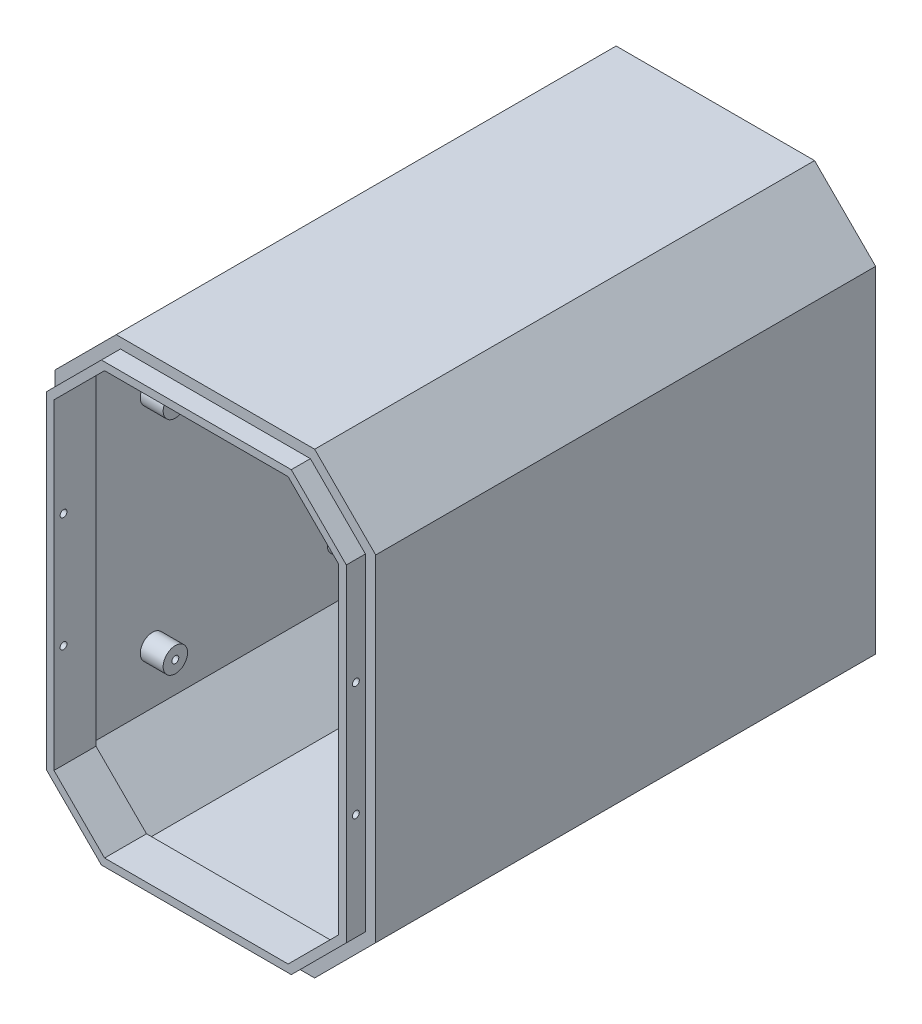
from build123d import *

# Parameters (mm, degrees)
BOSS_1_DEPTH   = 131
CUT_2_DEPTH    = 96.675
CUT_3_DEPTH    = 32.025
S_CUT4_W       = 8
S_CUT4_H       = 28
POCKET_4_DEPTH = 2.7
S_HOLE5_R      = 6
HOLE_5_DEPTH   = 2.7
S_CUT6_W       = 19.4
S_CUT6_H       = 6.3
POCKET_6_DEPTH = 2.7
S_CUT7_W       = 19.4
S_CUT7_H       = 6.3
POCKET_7_DEPTH = 2.7
S_HOLE8_R      = 1.7
HOLE_8_DEPTH   = 2.7
S_HOLE9_R      = 1.7
HOLE_9_DEPTH   = 2.7
S_HOLE10_R     = 1.7
HOLE_10_DEPTH  = 2.7
S_HOLE11_R     = 1.7
HOLE_11_DEPTH  = 2.7
BOSS_12_DEPTH  = 6
BOSS_13_DEPTH  = 5.1
S_CYL14_R      = 3.2
BOSS_14_DEPTH  = 6.5
S_CYL15_R      = 3.2
BOSS_15_DEPTH  = 6.5
S_CYL16_R      = 3.2
BOSS_16_DEPTH  = 6.5
S_CYL17_R      = 3.2
BOSS_17_DEPTH  = 6.5
CUT_18_DEPTH   = 11.2
S_HOLE19_R     = 0.9
HOLE_19_DEPTH  = 2.7
S_HOLE20_R     = 0.9
HOLE_20_DEPTH  = 2.7
S_HOLE21_R     = 0.9
HOLE_21_DEPTH  = 2.7
S_HOLE22_R     = 0.9
HOLE_22_DEPTH  = 2.7
S_HOLE23_R     = 0.9
HOLE_23_DEPTH  = 7.2
S_HOLE24_R     = 0.9
HOLE_24_DEPTH  = 7.2
S_HOLE25_R     = 0.9
HOLE_25_DEPTH  = 7.2
S_HOLE26_R     = 0.9
HOLE_26_DEPTH  = 7.2


with BuildPart() as part:
    # S_prism1 → Boss_1 (new body)
    with BuildSketch(Plane.XY.offset(37)):
        Polygon((42, -44), (42, 44), (26, 60), (-26, 60), (-42, 44), (-42, -44), (-26, -60), (26, -60), align=None)
    extrude(amount=BOSS_1_DEPTH)

    # S_pcut2 → Cut_2 (cut)
    with BuildSketch(Plane.XY.offset(71.425)):
        Polygon((39.5, -42.964466094), (39.5, 42.964466094), (24.964466094, 57.5), (-24.964466094, 57.5), (-39.5, 42.964466094), (-39.5, -42.964466094), (-24.964466094, -57.5), (24.964466094, -57.5), align=None)
    extrude(amount=CUT_2_DEPTH, mode=Mode.SUBTRACT)

    # S_pcut3 → Cut_3 (cut)
    with BuildSketch(Plane.XY.offset(36.9)):
        Polygon((39.5, -42.964466094), (39.5, 42.964466094), (24.964466094, 57.5), (-24.964466094, 57.5), (-39.5, 42.964466094), (-39.5, -42.964466094), (-24.964466094, -57.5), (24.964466094, -57.5), align=None)
    extrude(amount=CUT_3_DEPTH, mode=Mode.SUBTRACT)

    # S_cut4 → Pocket_4 (cut)
    with BuildSketch(Plane.XY.offset(68.825)):
        with Locations((-30, 0)):
            Rectangle(S_CUT4_W, S_CUT4_H)
    extrude(amount=POCKET_4_DEPTH, mode=Mode.SUBTRACT)

    # S_hole5 → Hole_5 (cut)
    with BuildSketch(Plane(origin=(-42.1, 0, 0), x_dir=(0, 0, -1), z_dir=(1, 0, 0))):
        with Locations((-88, 0)):
            Circle(S_HOLE5_R)
    extrude(amount=HOLE_5_DEPTH, mode=Mode.SUBTRACT)

    # S_cut6 → Pocket_6 (cut)
    with BuildSketch(Plane.XY.offset(68.825)):
        with Locations((0, 30.95)):
            Rectangle(S_CUT6_W, S_CUT6_H)
    extrude(amount=POCKET_6_DEPTH, mode=Mode.SUBTRACT)

    # S_cut7 → Pocket_7 (cut)
    with BuildSketch(Plane.XY.offset(68.825)):
        with Locations((0, -30.95)):
            Rectangle(S_CUT7_W, S_CUT7_H)
    extrude(amount=POCKET_7_DEPTH, mode=Mode.SUBTRACT)

    # S_hole8 → Hole_8 (cut)
    with BuildSketch(Plane.XY.offset(68.825)):
        with Locations((-20, -25)):
            Circle(S_HOLE8_R)
    extrude(amount=HOLE_8_DEPTH, mode=Mode.SUBTRACT)

    # S_hole9 → Hole_9 (cut)
    with BuildSketch(Plane.XY.offset(68.825)):
        with Locations((-20, 25)):
            Circle(S_HOLE9_R)
    extrude(amount=HOLE_9_DEPTH, mode=Mode.SUBTRACT)

    # S_hole10 → Hole_10 (cut)
    with BuildSketch(Plane.XY.offset(68.825)):
        with Locations((24, -25)):
            Circle(S_HOLE10_R)
    extrude(amount=HOLE_10_DEPTH, mode=Mode.SUBTRACT)

    # S_hole11 → Hole_11 (cut)
    with BuildSketch(Plane.XY.offset(68.825)):
        with Locations((24, 25)):
            Circle(S_HOLE11_R)
    extrude(amount=HOLE_11_DEPTH, mode=Mode.SUBTRACT)

    # S_prism12 → Boss_12 (add)
    with BuildSketch(Plane.XY.offset(162)):
        Polygon((40, -43.171572875), (40, 43.171572875), (25.171572875, 58), (-25.171572875, 58), (-40, 43.171572875), (-40, -43.171572875), (-25.171572875, -58), (25.171572875, -58), align=None)
    extrude(amount=BOSS_12_DEPTH)

    # S_prism13 → Boss_13 (add)
    with BuildSketch(Plane.XY.offset(167.9)):
        Polygon((39.3, -42.881623382), (39.3, 42.881623382), (24.881623382, 57.3), (-24.881623382, 57.3), (-39.3, 42.881623382), (-39.3, -42.881623382), (-24.881623382, -57.3), (24.881623382, -57.3), align=None)
    extrude(amount=BOSS_13_DEPTH)

    # S_cyl14 → Boss_14 (add)
    with BuildSketch(Plane(origin=(-40, 0, 0), x_dir=(0, 0, -1), z_dir=(1, 0, 0))):
        with Locations((-96, -29)):
            Circle(S_CYL14_R)
    extrude(amount=BOSS_14_DEPTH)

    # S_cyl15 → Boss_15 (add)
    with BuildSketch(Plane(origin=(-40, 0, 0), x_dir=(0, 0, -1), z_dir=(1, 0, 0))):
        with Locations((-145, -29)):
            Circle(S_CYL15_R)
    extrude(amount=BOSS_15_DEPTH)

    # S_cyl16 → Boss_16 (add)
    with BuildSketch(Plane(origin=(-40, 0, 0), x_dir=(0, 0, -1), z_dir=(1, 0, 0))):
        with Locations((-96, 29)):
            Circle(S_CYL16_R)
    extrude(amount=BOSS_16_DEPTH)

    # S_cyl17 → Boss_17 (add)
    with BuildSketch(Plane(origin=(-40, 0, 0), x_dir=(0, 0, -1), z_dir=(1, 0, 0))):
        with Locations((-145, 29)):
            Circle(S_CYL17_R)
    extrude(amount=BOSS_17_DEPTH)

    # S_pcut18 → Cut_18 (cut)
    with BuildSketch(Plane.XY.offset(161.9)):
        Polygon((37.3, -42.053196257), (37.3, 42.053196257), (24.053196257, 55.3), (-24.053196257, 55.3), (-37.3, 42.053196257), (-37.3, -42.053196257), (-24.053196257, -55.3), (24.053196257, -55.3), align=None)
    extrude(amount=CUT_18_DEPTH, mode=Mode.SUBTRACT)

    # S_hole19 → Hole_19 (cut)
    with BuildSketch(Plane(origin=(37.1, 0, 0), x_dir=(0, 0, -1), z_dir=(1, 0, 0))):
        with Locations((-170.5, -15)):
            Circle(S_HOLE19_R)
    extrude(amount=HOLE_19_DEPTH, mode=Mode.SUBTRACT)

    # S_hole20 → Hole_20 (cut)
    with BuildSketch(Plane(origin=(37.1, 0, 0), x_dir=(0, 0, -1), z_dir=(1, 0, 0))):
        with Locations((-170.5, 15)):
            Circle(S_HOLE20_R)
    extrude(amount=HOLE_20_DEPTH, mode=Mode.SUBTRACT)

    # S_hole21 → Hole_21 (cut)
    with BuildSketch(Plane(origin=(-39.8, 0, 0), x_dir=(0, 0, -1), z_dir=(1, 0, 0))):
        with Locations((-170.5, -15)):
            Circle(S_HOLE21_R)
    extrude(amount=HOLE_21_DEPTH, mode=Mode.SUBTRACT)

    # S_hole22 → Hole_22 (cut)
    with BuildSketch(Plane(origin=(-39.8, 0, 0), x_dir=(0, 0, -1), z_dir=(1, 0, 0))):
        with Locations((-170.5, 15)):
            Circle(S_HOLE22_R)
    extrude(amount=HOLE_22_DEPTH, mode=Mode.SUBTRACT)

    # S_hole23 → Hole_23 (cut)
    with BuildSketch(Plane(origin=(-40.6, 0, 0), x_dir=(0, 0, -1), z_dir=(1, 0, 0))):
        with Locations((-96, -29)):
            Circle(S_HOLE23_R)
    extrude(amount=HOLE_23_DEPTH, mode=Mode.SUBTRACT)

    # S_hole24 → Hole_24 (cut)
    with BuildSketch(Plane(origin=(-40.6, 0, 0), x_dir=(0, 0, -1), z_dir=(1, 0, 0))):
        with Locations((-145, -29)):
            Circle(S_HOLE24_R)
    extrude(amount=HOLE_24_DEPTH, mode=Mode.SUBTRACT)

    # S_hole25 → Hole_25 (cut)
    with BuildSketch(Plane(origin=(-40.6, 0, 0), x_dir=(0, 0, -1), z_dir=(1, 0, 0))):
        with Locations((-96, 29)):
            Circle(S_HOLE25_R)
    extrude(amount=HOLE_25_DEPTH, mode=Mode.SUBTRACT)

    # S_hole26 → Hole_26 (cut)
    with BuildSketch(Plane(origin=(-40.6, 0, 0), x_dir=(0, 0, -1), z_dir=(1, 0, 0))):
        with Locations((-145, 29)):
            Circle(S_HOLE26_R)
    extrude(amount=HOLE_26_DEPTH, mode=Mode.SUBTRACT)


solid = part.part
